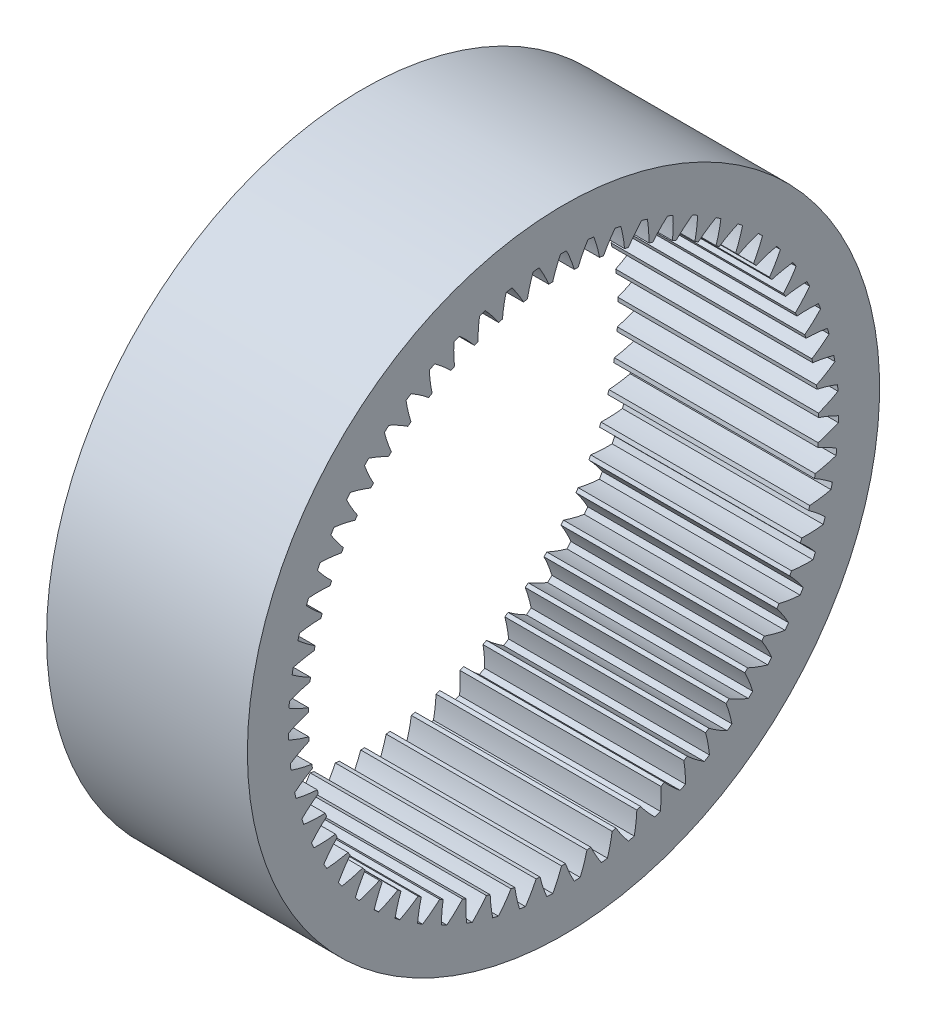
from build123d import *

# Parameters (mm, degrees)
BASPROSKE_W         = 22.815
BASPROSKE_H         = 2.2764
TOOTHCUT_DEPTH      = 50.768972452
TEETHCUTS_COUNT     = 63
SCALE1_SCALE        = 2
SKETCH2_R           = 72.5528
SKETCH2_R_2         = 62.5528
BOSS_EXTRUDE1_DEPTH = 45.63
SCALE2_SCALE        = 1.1
SCALE3_SCALE        = 1.01
SCALE4_SCALE        = 0.99009901
SCALE5_SCALE        = 0.909090909
SCALE6_SCALE        = 1.01
SKETCH3_R           = 73.278328
SKETCH3_R_2         = 72.5528
CUT_EXTRUDE1_DEPTH  = 114.416814259


with BuildPart() as part:
    # BasProSke → Base-Revolve (revolve)
    with BuildSketch(Plane(origin=(0, 0, 0), x_dir=(1, 0, 0), z_dir=(0, 1, 0))):
        with Locations((11.4075, 30.1382)):
            Rectangle(BASPROSKE_W, BASPROSKE_H)
    revolve(axis=Axis((-10, 0, 0), (1, 0, 0)))

    # TooCutSke → ToothCut (cut, through all)
    with BuildSketch(Plane(origin=(0, 0, 0), x_dir=(0, 0, -1), z_dir=(1, 0, 0))):
        with BuildLine():
            ThreePointArc((1.227357706, 28.948593027), (0.830805794, 30.117149174), (0.339543276, 31.24915537))
            ThreePointArc((0.339543276, 31.24915537), (0, 31.251), (-0.339543276, 31.24915537))
            ThreePointArc((-0.339543276, 31.24915537), (-0.830805794, 30.117149174), (-1.227357706, 28.948593027))
            ThreePointArc((-1.227357706, 28.948593027), (0, 28.9746), (1.227357706, 28.948593027))
        make_face()
    toothcut = extrude(amount=TOOTHCUT_DEPTH, mode=Mode.SUBTRACT)

    # TeethCuts: ToothCut ×63 about axis
    teethcuts_axis = Axis((-10, 0, 0), (1, 0, 0))
    for i in range(1, TEETHCUTS_COUNT):
        add(toothcut.rotate(teethcuts_axis, i * 360 / TEETHCUTS_COUNT), mode=Mode.SUBTRACT)


with BuildPart() as part_1:
    # Scale1: scaled about (11.4075, 0, 0)
    add(part.part.scale(SCALE1_SCALE).moved(Location((-11.4075, 0, 0))))

    # Sketch2 → Boss-Extrude1 (add)
    with BuildSketch(Plane(origin=(34.2225, 0, 0), x_dir=(0, 0, -1), z_dir=(1, 0, 0))):
        Circle(SKETCH2_R)
        Circle(SKETCH2_R_2, mode=Mode.SUBTRACT)
    extrude(amount=-BOSS_EXTRUDE1_DEPTH)


with BuildPart() as part_2:
    # Scale2: scaled about (11.4075, 0, 0)
    add(part_1.part.scale(SCALE2_SCALE).moved(Location((-1.14075, 0, 0))))


with BuildPart() as part_3:
    # Scale3: scaled about (11.4075, 0, 0)
    add(part_2.part.scale(SCALE3_SCALE).moved(Location((-0.114075, 0, 0))))


with BuildPart() as part_4:
    # Scale4: scaled about (11.4075, 0, 0)
    add(part_3.part.scale(SCALE4_SCALE).moved(Location((0.112945545, 0, 0))))


with BuildPart() as part_5:
    # Scale5: scaled about (11.4075, 0, 0)
    add(part_4.part.scale(SCALE5_SCALE).moved(Location((1.037045455, 0, 0))))


with BuildPart() as part_6:
    # Scale6: scaled about (11.4075, 0, 0)
    add(part_5.part.scale(SCALE6_SCALE).moved(Location((-0.114075, 0, 0))))

    # Sketch3 → Cut-Extrude1 (cut, through all)
    with BuildSketch(Plane.ZY.offset(11.63565)):
        Circle(SKETCH3_R)
        Circle(SKETCH3_R_2, mode=Mode.SUBTRACT)
    extrude(amount=-CUT_EXTRUDE1_DEPTH, mode=Mode.SUBTRACT)


solid = part_6.part
